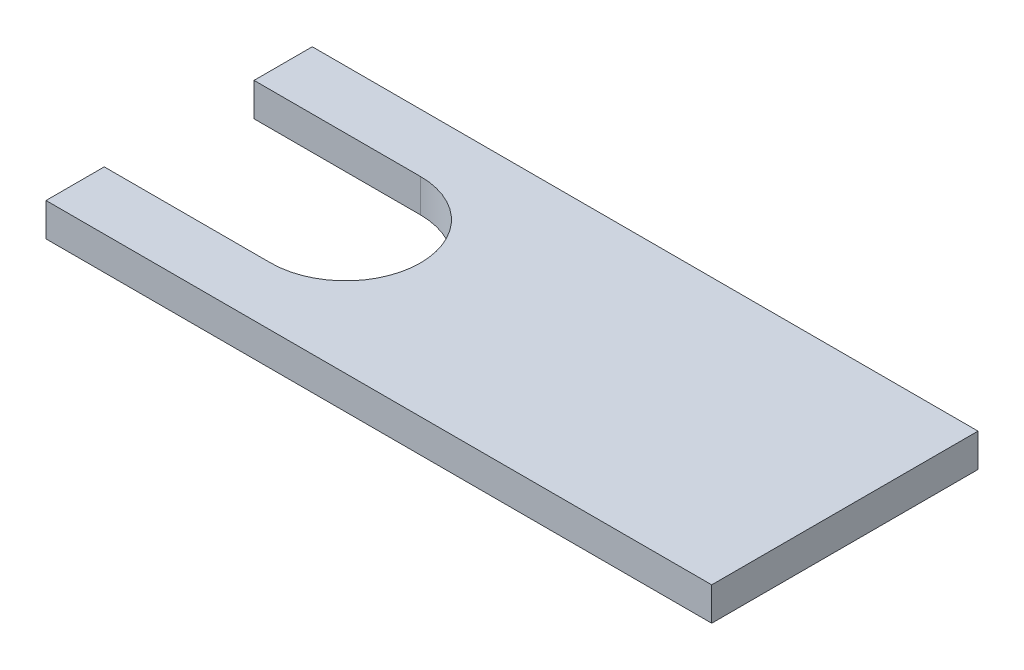
from build123d import *

# Parameters (mm, degrees)
BOSS_EXTRUDE1_DEPTH = 1


with BuildPart() as part:
    # Sketch1 → Boss-Extrude1 (new body)
    with BuildSketch(Plane(origin=(0, 0, 0), x_dir=(1, 0, 0), z_dir=(0, 1, 0))):
        with BuildLine():
            Line((0, 4), (0, 2.25))
            Line((0, 2.25), (5, 2.25))
            ThreePointArc((5, 2.25), (7.25, 0), (5, -2.25))
            Line((5, -2.25), (0, -2.25))
            Line((0, -2.25), (0, -4))
            Line((0, -4), (20, -4))
            Line((20, -4), (20, 4))
            Line((20, 4), (0, 4))
        make_face()
    extrude(amount=BOSS_EXTRUDE1_DEPTH)


solid = part.part
